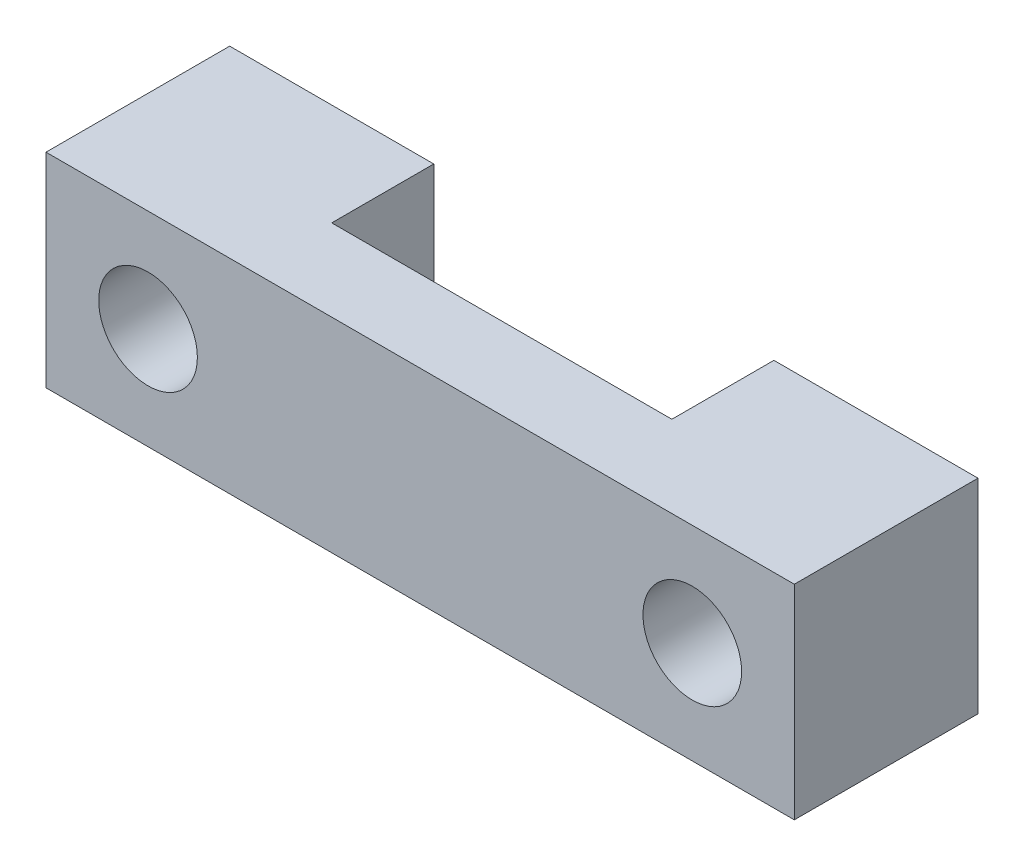
from build123d import *

# Parameters (mm, degrees)
SKETCH1_W           = 27.94
SKETCH1_H           = 7.62
SKETCH1_R           = 1.8415
BOSS_EXTRUDE1_DEPTH = 6.858
SKETCH2_W           = 12.7
SKETCH2_H           = 3.81
CUT_EXTRUDE1_DEPTH  = 18.327938827


with BuildPart() as part:
    # Sketch1 → Boss-Extrude1 (new body)
    with BuildSketch(Plane.XY):
        Rectangle(SKETCH1_W, SKETCH1_H)
        with Locations((-10.16, 0)):
            Circle(SKETCH1_R, mode=Mode.SUBTRACT)
        with Locations((10.16, 0)):
            Circle(SKETCH1_R, mode=Mode.SUBTRACT)
    extrude(amount=BOSS_EXTRUDE1_DEPTH)

    # Sketch2 → Cut-Extrude1 (cut, through all)
    with BuildSketch(Plane(origin=(0, 3.81, 0), x_dir=(1, 0, 0), z_dir=(0, 1, 0))):
        with Locations((0, -1.905)):
            Rectangle(SKETCH2_W, SKETCH2_H)
    extrude(amount=-CUT_EXTRUDE1_DEPTH, mode=Mode.SUBTRACT)


solid = part.part
